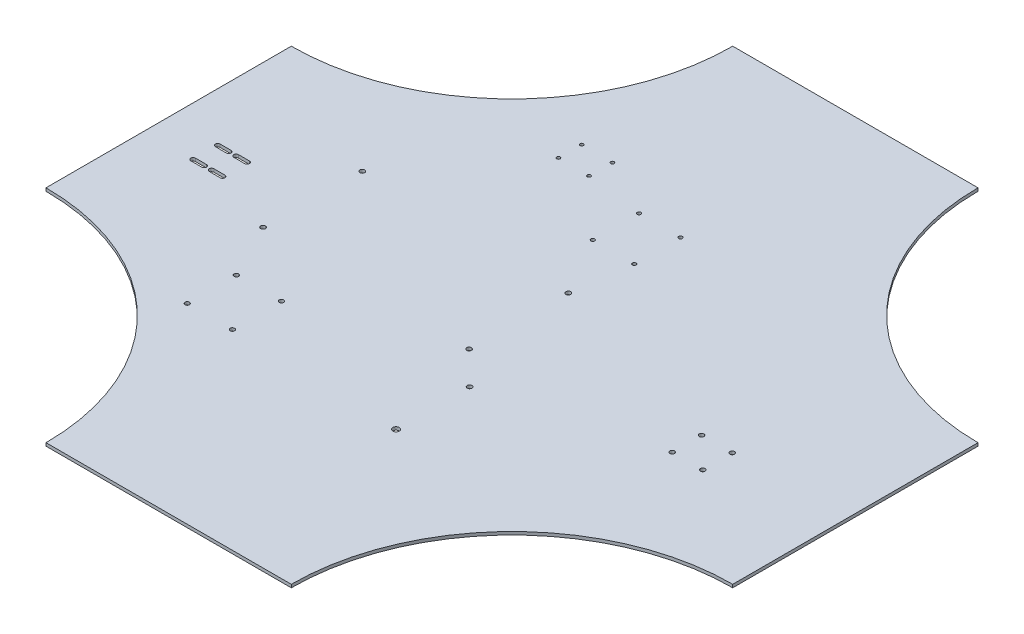
from build123d import *

# Parameters (mm, degrees)
BOSS_EXTRUDE1_DEPTH     = 3.175
CUT_EXTRUDE1_DEPTH      = 503.904365287
CUT_EXTRUDE1_DEPTH_BACK = 503.904365287
SKETCH4_R               = 2.413
CUT_EXTRUDE2_DEPTH      = 503.904365287
SKETCH5_R               = 2.5
SKETCH5_R_2             = 2.47796547
CUT_EXTRUDE3_DEPTH      = 503.904365287
SKETCH6_R               = 2.321781934
SKETCH6_R_2             = 3.342982458
SKETCH6_R_3             = 2.5
SKETCH6_R_4             = 1.905
SKETCH6_R_5             = 1.75
CUT_EXTRUDE4_DEPTH      = 503.904365287


with BuildPart() as part:
    # Sketch1 → Boss-Extrude1 (new body)
    with BuildSketch(Plane(origin=(0, 0, 0), x_dir=(1, 0, 0), z_dir=(0, 1, 0))):
        with BuildLine():
            Line((-127, -355.6), (127, -355.6))
            ThreePointArc((127, -355.6), (193.955389821, -193.955389821), (355.6, -127))
            Line((355.6, -127), (355.6, 127))
            ThreePointArc((355.6, 127), (193.955389821, 193.955389821), (127, 355.6))
            Line((127, 355.6), (-127, 355.6))
            ThreePointArc((-127, 355.6), (-193.955389821, 193.955389821), (-355.6, 127))
            Line((-355.6, 127), (-355.6, -127))
            ThreePointArc((-355.6, -127), (-193.955389821, -193.955389821), (-127, -355.6))
        make_face()
    extrude(amount=BOSS_EXTRUDE1_DEPTH)

    # Sketch2 → Cut-Extrude1 (cut, two sides: drawn at the far end of the back side and taken through both)
    with BuildSketch(Plane(origin=(0, 3.175, 0), x_dir=(1, 0, 0), z_dir=(0, 1, 0)).offset(-CUT_EXTRUDE1_DEPTH_BACK)):
        with BuildLine():
            Line((-304.8, 2.413), (-293.37, 2.413))
            ThreePointArc((-293.37, 2.413), (-290.957, 0), (-293.37, -2.413))
            Line((-293.37, -2.413), (-304.8, -2.413))
            ThreePointArc((-304.8, -2.413), (-307.213, 0), (-304.8, 2.413))
        make_face()
        with BuildLine():
            Line((-304.8, -22.987), (-293.37, -22.987))
            ThreePointArc((-293.37, -22.987), (-290.957, -25.4), (-293.37, -27.813))
            Line((-293.37, -27.813), (-304.8, -27.813))
            ThreePointArc((-304.8, -27.813), (-307.213, -25.4), (-304.8, -22.987))
        make_face()
        with BuildLine():
            Line((-285.75, -2.413), (-274.32, -2.413))
            ThreePointArc((-274.32, -2.413), (-271.907, 0), (-274.32, 2.413))
            Line((-274.32, 2.413), (-285.75, 2.413))
            ThreePointArc((-285.75, 2.413), (-288.163, 0), (-285.75, -2.413))
        make_face()
        with BuildLine():
            Line((-285.75, -22.987), (-274.32, -22.987))
            ThreePointArc((-274.32, -22.987), (-271.907, -25.4), (-274.32, -27.813))
            Line((-274.32, -27.813), (-285.75, -27.813))
            ThreePointArc((-285.75, -27.813), (-288.163, -25.4), (-285.75, -22.987))
        make_face()
    extrude(amount=CUT_EXTRUDE1_DEPTH + CUT_EXTRUDE1_DEPTH_BACK, mode=Mode.SUBTRACT)

    # Sketch4 → Cut-Extrude2 (cut, through all)
    with BuildSketch(Plane(origin=(0, 3.175, 0), x_dir=(1, 0, 0), z_dir=(0, 1, 0))):
        with Locations((237.49, -9.430177049)):
            Circle(SKETCH4_R)
        with Locations((205.74, -9.430177049)):
            Circle(SKETCH4_R)
        with Locations((237.49, -39.910177049)):
            Circle(SKETCH4_R)
        with Locations((205.74, -39.910177049)):
            Circle(SKETCH4_R)
    extrude(amount=-CUT_EXTRUDE2_DEPTH, mode=Mode.SUBTRACT)

    # Sketch5 → Cut-Extrude3 (cut, through all)
    with BuildSketch(Plane.XZ):
        with Locations((-207.790149601, 50.01656837)):
            Circle(SKETCH5_R)
        with Locations((-206.624048203, -51.576739518)):
            Circle(SKETCH5_R)
        with Locations((8.09562966, 52.494533839)):
            Circle(SKETCH5_R_2)
        with Locations((9.261731058, -49.098774048)):
            Circle(SKETCH5_R)
    extrude(amount=-CUT_EXTRUDE3_DEPTH, mode=Mode.SUBTRACT)

    # Sketch6 → Cut-Extrude4 (cut, through all)
    with BuildSketch(Plane.XZ):
        with Locations((-131.96570437, 157.594741445)):
            Circle(SKETCH6_R)
        with Locations((-131.96570437, 106.794741445)):
            Circle(SKETCH6_R)
        with Locations((-178.700591901, 106.794741445)):
            Circle(SKETCH6_R)
        with Locations((-178.700591901, 157.594741445)):
            Circle(SKETCH6_R)
        with Locations((42.265908941, 162.337536061)):
            Circle(SKETCH6_R_2)
        with Locations((42.265908941, 86.137536061)):
            Circle(SKETCH6_R_3)
        with Locations((17.371687145, -109.265722508)):
            Circle(SKETCH6_R_4)
        with Locations((-25.681149945, -109.384160374)):
            Circle(SKETCH6_R_4)
        with Locations((-25.549785233, -157.135979683)):
            Circle(SKETCH6_R_4)
        with Locations((17.503045383, -157.015188359)):
            Circle(SKETCH6_R_4)
        with Locations((-84.882409293, -188.871278488)):
            Circle(SKETCH6_R_5)
        with Locations((-85.091846145, -164.872192335)):
            Circle(SKETCH6_R_5)
        with Locations((-116.881190831, -189.150527624)):
            Circle(SKETCH6_R_5)
        with Locations((-117.090627683, -165.151441471)):
            Circle(SKETCH6_R_5)
    extrude(amount=-CUT_EXTRUDE4_DEPTH, mode=Mode.SUBTRACT)


solid = part.part
